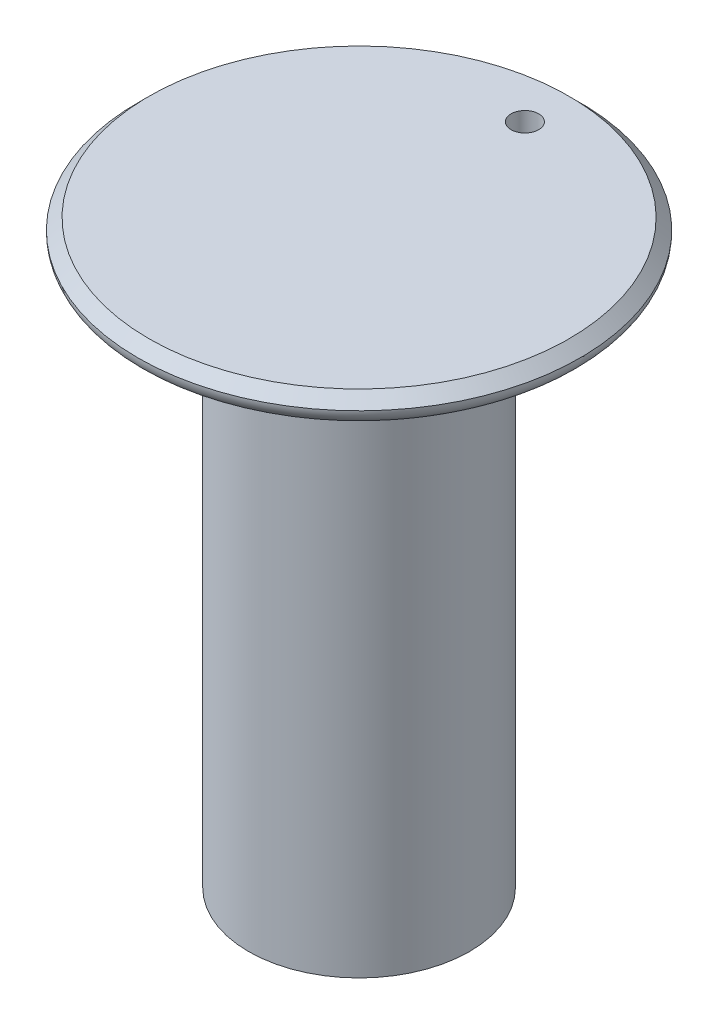
from build123d import *

# Parameters (mm, degrees)
SKETCH1_R               = 20
BOSS_EXTRUDE1_DEPTH     = 50
SKETCH3_R               = 40
BOSS_EXTRUDE2_DEPTH     = 5
CHAMFER1_SIZE           = 2
CUT_EXTRUDE1_DEPTH      = 120.268604419
CUT_EXTRUDE1_DEPTH_BACK = 120.268604419
SKETCH4_R               = 2.5
FILLET1_R               = 3


with BuildPart() as part:
    # Sketch1 → Boss-Extrude1 (new, symmetric)
    with BuildSketch(Plane(origin=(0, 0, 0), x_dir=(1, 0, 0), z_dir=(0, 1, 0))):
        with Locations(Location((0, 0, 0), (0, 0, 270))):
            Circle(SKETCH1_R)
    extrude(amount=BOSS_EXTRUDE1_DEPTH, both=True)

    # Sketch3 → Boss-Extrude2 (add)
    with BuildSketch(Plane(origin=(0, 50, 0), x_dir=(1, 0, 0), z_dir=(0, 1, 0))):
        with Locations(Location((0, 0, 0), (0, 0, 270))):
            Circle(SKETCH3_R)
    extrude(amount=BOSS_EXTRUDE2_DEPTH)

    # Chamfer1
    chamfer1_edges = [part.edges().sort_by_distance(p)[0] for p in [
        (0, 55, -40),
    ]]
    chamfer(chamfer1_edges, length=CHAMFER1_SIZE)

    # Sketch4 → Cut-Extrude1 (cut, two sides: drawn at the far end of the back side and taken through both)
    with BuildSketch(Plane(origin=(0, 55, 0), x_dir=(1, 0, 0), z_dir=(0, 1, 0)).offset(-CUT_EXTRUDE1_DEPTH_BACK)):
        with Locations(Location((0, 30, 0), (0, 0, 270))):
            Circle(SKETCH4_R)
    extrude(amount=CUT_EXTRUDE1_DEPTH + CUT_EXTRUDE1_DEPTH_BACK, mode=Mode.SUBTRACT)

    # Fillet1
    fillet1_edges = [part.edges().sort_by_distance(p)[0] for p in [
        (0, 50, -40),
    ]]
    fillet(fillet1_edges, radius=FILLET1_R - 0.0001)  # a hair under: the kernel refuses the full size


solid = part.part
